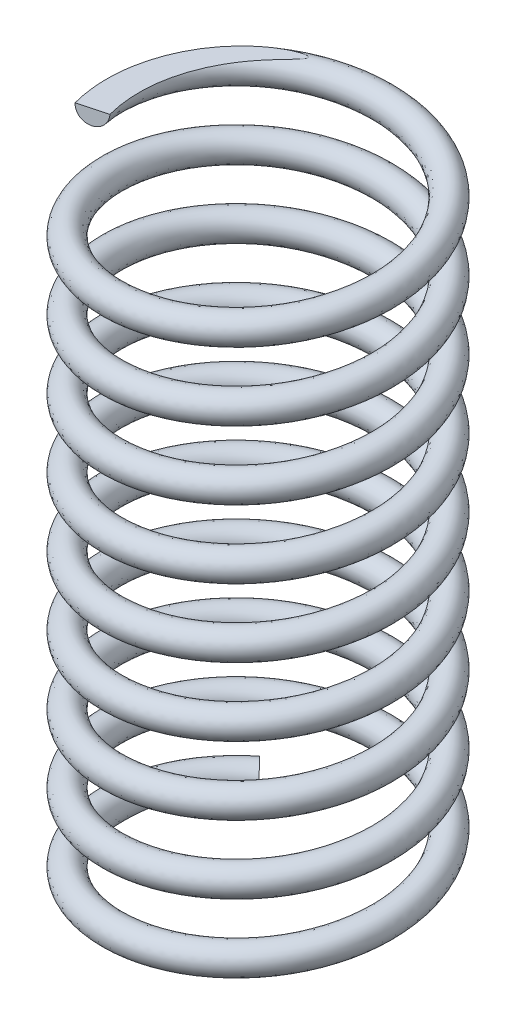
from build123d import *

# Parameters (mm, degrees)
SWEEP_1_PITCH            = 2.4
SWEEP_1_HEIGHT           = 22
SWEEP_1_RADIUS           = 4.75
SWEEP_1_START_ANGLE      = -135
SWEEP_1_PROFILE_R        = 0.5
CUT_EXTRUDE_1_DEPTH      = 24.691839046
CUT_EXTRUDE_1_DEPTH_BACK = 24.691839046
CUT_EXTRUDE_2_DEPTH      = 24.691839046
CUT_EXTRUDE_2_DEPTH_BACK = 24.691839046


with BuildPart() as part:
    # 扫描1: sweep along a helix
    with BuildLine() as sweep_1_path:
        add(Helix(SWEEP_1_PITCH, SWEEP_1_HEIGHT, SWEEP_1_RADIUS, center=(0, 0, 0), direction=(0, 1, 0), mode=Mode.PRIVATE).rotate(Axis((0, 0, 0), (0, 1, 0)), SWEEP_1_START_ANGLE))
    # 扫描1 profile (on start of the path) → 扫描1 (sweep)
    with BuildSketch(Plane(origin=(-3.358757211, 0, -3.358757211), x_dir=(-0.707106781186504, 0, -0.7071067811865911), z_dir=(-0.7048315242507656, 0.08015637744314023, 0.7048315242506789))):
        Circle(SWEEP_1_PROFILE_R)
    sweep(path=sweep_1_path.line, is_frenet=True)

    # 草图10 → 切除-拉伸1 (cut, two sides: drawn at the far end of the back side and taken through both)
    with BuildSketch(Plane.XY.offset(-CUT_EXTRUDE_1_DEPTH_BACK)):
        Polygon((-70.270042151, 0), (-6.042981359, 0), (9.881604738, 0), (74.10866553, 0), (74.10866553, -128.454121583), (-70.270042151, -128.454121583), align=None)
    extrude(amount=CUT_EXTRUDE_1_DEPTH + CUT_EXTRUDE_1_DEPTH_BACK, mode=Mode.SUBTRACT)

    # 草图11 → 切除-拉伸2 (cut, two sides: drawn at the far end of the back side and taken through both)
    with BuildSketch(Plane.XY.offset(-CUT_EXTRUDE_2_DEPTH_BACK)):
        Polygon((73.343739899, 22), (9.492393384, 22), (-9.542364462, 22), (-73.393710977, 22), (-73.393710977, 149.702693031), (73.343739899, 149.702693031), align=None)
    extrude(amount=CUT_EXTRUDE_2_DEPTH + CUT_EXTRUDE_2_DEPTH_BACK, mode=Mode.SUBTRACT)


solid = part.part
